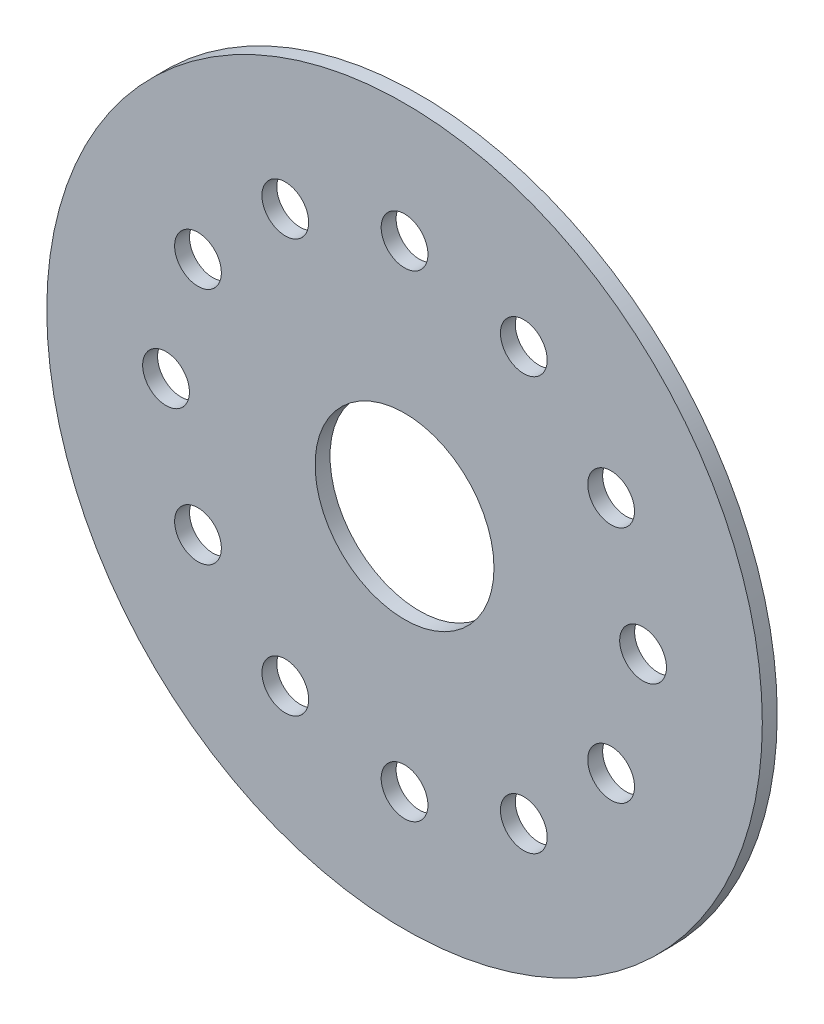
from build123d import *

# Parameters (mm, degrees)
SKETCH1_R           = 38.1
SKETCH1_R_2         = 9.525
SKETCH1_R_3         = 2.4892
BOSS_EXTRUDE1_DEPTH = 1.5875


with BuildPart() as part:
    # Sketch1 → Boss-Extrude1 (new body)
    with BuildSketch(Plane.XY):
        Circle(SKETCH1_R)
        Circle(SKETCH1_R_2, mode=Mode.SUBTRACT)
        with Locations((0, 25.4)):
            Circle(SKETCH1_R_3, mode=Mode.SUBTRACT)
        with Locations((12.7, 21.997045256)):
            Circle(SKETCH1_R_3, mode=Mode.SUBTRACT)
        with Locations((21.997045256, 12.7)):
            Circle(SKETCH1_R_3, mode=Mode.SUBTRACT)
        with Locations((25.4, 0)):
            Circle(SKETCH1_R_3, mode=Mode.SUBTRACT)
        with Locations((21.997045256, -12.7)):
            Circle(SKETCH1_R_3, mode=Mode.SUBTRACT)
        with Locations((12.7, -21.997045256)):
            Circle(SKETCH1_R_3, mode=Mode.SUBTRACT)
        with Locations((0, -25.4)):
            Circle(SKETCH1_R_3, mode=Mode.SUBTRACT)
        with Locations((-12.7, -21.997045256)):
            Circle(SKETCH1_R_3, mode=Mode.SUBTRACT)
        with Locations((-21.997045256, -12.7)):
            Circle(SKETCH1_R_3, mode=Mode.SUBTRACT)
        with Locations((-25.4, 0)):
            Circle(SKETCH1_R_3, mode=Mode.SUBTRACT)
        with Locations((-21.997045256, 12.7)):
            Circle(SKETCH1_R_3, mode=Mode.SUBTRACT)
        with Locations((-12.7, 21.997045256)):
            Circle(SKETCH1_R_3, mode=Mode.SUBTRACT)
    extrude(amount=BOSS_EXTRUDE1_DEPTH)


solid = part.part
